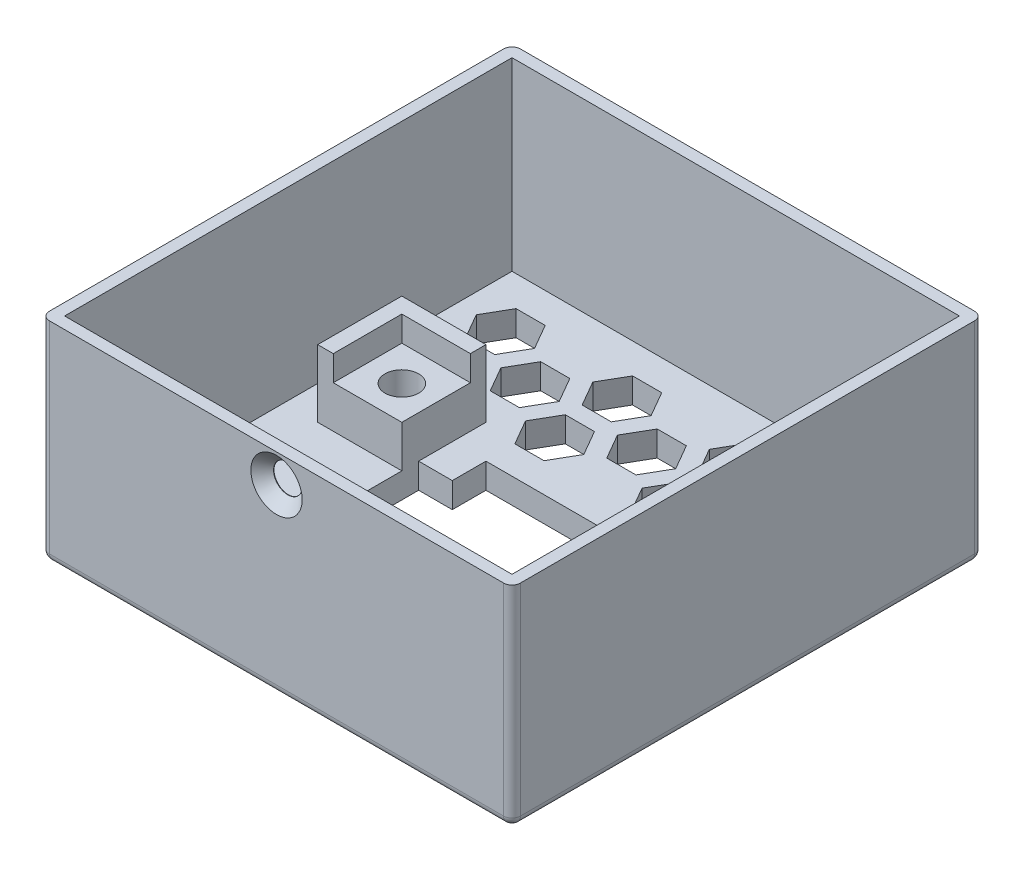
from build123d import *

# Parameters (mm, degrees)
SKETCH1_W           = 56
SKETCH1_H           = 56
BOSS_EXTRUDE1_DEPTH = 25
SKETCH2_W           = 53.2
SKETCH2_H           = 53.2
CUT_EXTRUDE1_DEPTH  = 22
SKETCH3_R           = 1.7
CUT_EXTRUDE2_DEPTH  = 1.4
SKETCH4_W           = 25.2
SKETCH4_H           = 27.2
CUT_EXTRUDE3_DEPTH  = 3
SKETCH5_W           = 4
SKETCH5_H           = 4
BOSS_EXTRUDE2_DEPTH = 3
SKETCH6_W           = 8
SKETCH6_H           = 8
BOSS_EXTRUDE3_DEPTH = 5
SKETCH7_R           = 2
CUT_EXTRUDE4_DEPTH  = 8
BOSS_EXTRUDE4_DEPTH = 3
FILLET1_R           = 1
CHAMFER1_SIZE       = 1.35
FILL_PATTERN1_DEPTH = 3


# Read off the part's stored shape, not the designer's step: Fill Pattern1
with BuildPart() as part:
    # Sketch1 → Boss-Extrude1 (new body)
    with BuildSketch(Plane(origin=(0, 0, 0), x_dir=(1, 0, 0), z_dir=(0, 1, 0))):
        Rectangle(SKETCH1_W, SKETCH1_H)
    extrude(amount=BOSS_EXTRUDE1_DEPTH)

    # Sketch2 → Cut-Extrude1 (cut)
    with BuildSketch(Plane(origin=(0, 25, 0), x_dir=(1, 0, 0), z_dir=(0, 1, 0))):
        Rectangle(SKETCH2_W, SKETCH2_H)
    extrude(amount=-CUT_EXTRUDE1_DEPTH, mode=Mode.SUBTRACT)

    # Sketch3 → Cut-Extrude2 (cut)
    with BuildSketch(Plane.XY.offset(28)):
        with Locations((0, 21.6)):
            Circle(SKETCH3_R)
    extrude(amount=-CUT_EXTRUDE2_DEPTH, mode=Mode.SUBTRACT)

    # Sketch4 → Cut-Extrude3 (cut)
    with BuildSketch(Plane.XZ):
        with Locations((0, 8.1)):
            Rectangle(SKETCH4_W, SKETCH4_H)
    extrude(amount=-CUT_EXTRUDE3_DEPTH, mode=Mode.SUBTRACT)

    # Sketch5 → Boss-Extrude2 (add)
    with BuildSketch(Plane.XZ):
        with Locations((-10.6, 19.7)):
            Rectangle(SKETCH5_W, SKETCH5_H)
        with Locations((10.6, 19.7)):
            Rectangle(SKETCH5_W, SKETCH5_H)
        with Locations((10.6, -3.5)):
            Rectangle(SKETCH5_W, SKETCH5_H)
        with Locations((-10.6, -3.5)):
            Rectangle(SKETCH5_W, SKETCH5_H)
    extrude(amount=-BOSS_EXTRUDE2_DEPTH)

    # Sketch6 → Boss-Extrude3 (add)
    with BuildSketch(Plane(origin=(0, 3, 0), x_dir=(1, 0, 0), z_dir=(0, 1, 0))):
        with Locations((16.6, -19.7)):
            Rectangle(SKETCH6_W, SKETCH6_H)
        with Locations((-16.6, -19.7)):
            Rectangle(SKETCH6_W, SKETCH6_H)
        Polygon((12.6, -0.5), (20.6, -0.5), (22.6, -0.5), (22.6, 9.5), (12.6, 9.5), (12.6, 7.5), align=None)
        Polygon((-12.6, -0.5), (-20.6, -0.5), (-22.6, -0.5), (-22.6, 9.5), (-12.6, 9.5), (-12.6, 7.5), align=None)
    extrude(amount=BOSS_EXTRUDE3_DEPTH)

    # Sketch7 → Cut-Extrude4 (cut)
    with BuildSketch(Plane(origin=(0, 8, 0), x_dir=(1, 0, 0), z_dir=(0, 1, 0))):
        with Locations(Location((16.6, -19.7, 0), (0, 0, 270))):
            Circle(SKETCH7_R)
        with Locations(Location((-16.6, -19.7, 0), (0, 0, 270))):
            Circle(SKETCH7_R)
        with Locations(Location((16.6, 3.5, 0), (0, 0, 270))):
            Circle(SKETCH7_R)
        with Locations(Location((-16.6, 3.5, 0), (0, 0, 270))):
            Circle(SKETCH7_R)
    extrude(amount=-CUT_EXTRUDE4_DEPTH, mode=Mode.SUBTRACT)

    # Sketch9 → Boss-Extrude4 (add)
    with BuildSketch(Plane(origin=(0, 8, 0), x_dir=(1, 0, 0), z_dir=(0, 1, 0))):
        Polygon((-22.6, -0.5), (-22.6, 9.5), (-12.6, 9.5), (-12.6, 7.65), (-20.75, 7.65), (-20.75, -0.5), align=None)
        Polygon((12.6, 9.5), (22.6, 9.5), (22.6, -0.5), (20.75, -0.5), (20.75, 7.65), (12.6, 7.65), align=None)
    extrude(amount=BOSS_EXTRUDE4_DEPTH)

    # Fillet1
    fillet1_edges = [part.edges().sort_by_distance(p)[0] for p in [
        (0, 0, 28),
        (-28, 0, 0),
        (0, 0, -28),
        (28, 0, 0),
        (28, 12.5, 28),
        (-28, 12.5, 28),
        (-28, 12.5, -28),
        (28, 12.5, -28),
    ]]
    fillet(fillet1_edges, radius=FILLET1_R)

    # Chamfer1
    chamfer1_edges = [part.edges().sort_by_distance(p)[0] for p in [
        (-1.7, 21.6, 28),
    ]]
    chamfer(chamfer1_edges, length=CHAMFER1_SIZE)

    # Fill Pattern1 outline → Fill Pattern1 (cut)
    with BuildSketch(Plane(origin=(0, 0, 0), x_dir=(1, 0, 0), z_dir=(0, 1, 0))):
        Polygon((22.516660498, 17), (24.248711306, 20), (22.516660498, 23), (19.052558883, 23), (17.320508076, 20), (19.052558883, 17), align=None)
        Polygon((8.660254038, 23), (5.196152423, 23), (3.464101615, 20), (5.196152423, 17), (8.660254038, 17), (10.392304845, 20), align=None)
        Polygon((-5.196152423, 23), (-8.660254038, 23), (-10.392304845, 20), (-8.660254038, 17), (-5.196152423, 17), (-3.464101615, 20), align=None)
        Polygon((-19.052558883, 23), (-22.516660498, 23), (-24.248711306, 20), (-22.516660498, 17), (-19.052558883, 17), (-17.320508076, 20), align=None)
        Polygon((1.732050808, 13), (3.464101615, 16), (1.732050808, 19), (-1.732050808, 19), (-3.464101615, 16), (-1.732050808, 13), align=None)
        Polygon((-12.124355653, 19), (-15.588457268, 19), (-17.320508076, 16), (-15.588457268, 13), (-12.124355653, 13), (-10.392304845, 16), align=None)
        Polygon((15.588457268, 19), (12.124355653, 19), (10.392304845, 16), (12.124355653, 13), (15.588457268, 13), (17.320508076, 16), align=None)
        Polygon((8.660254038, 9), (10.392304845, 12), (8.660254038, 15), (5.196152423, 15), (3.464101615, 12), (5.196152423, 9), align=None)
        Polygon((-5.196152423, 15), (-8.660254038, 15), (-10.392304845, 12), (-8.660254038, 9), (-5.196152423, 9), (-3.464101615, 12), align=None)
    extrude(amount=FILL_PATTERN1_DEPTH, mode=Mode.SUBTRACT)


solid = part.part
